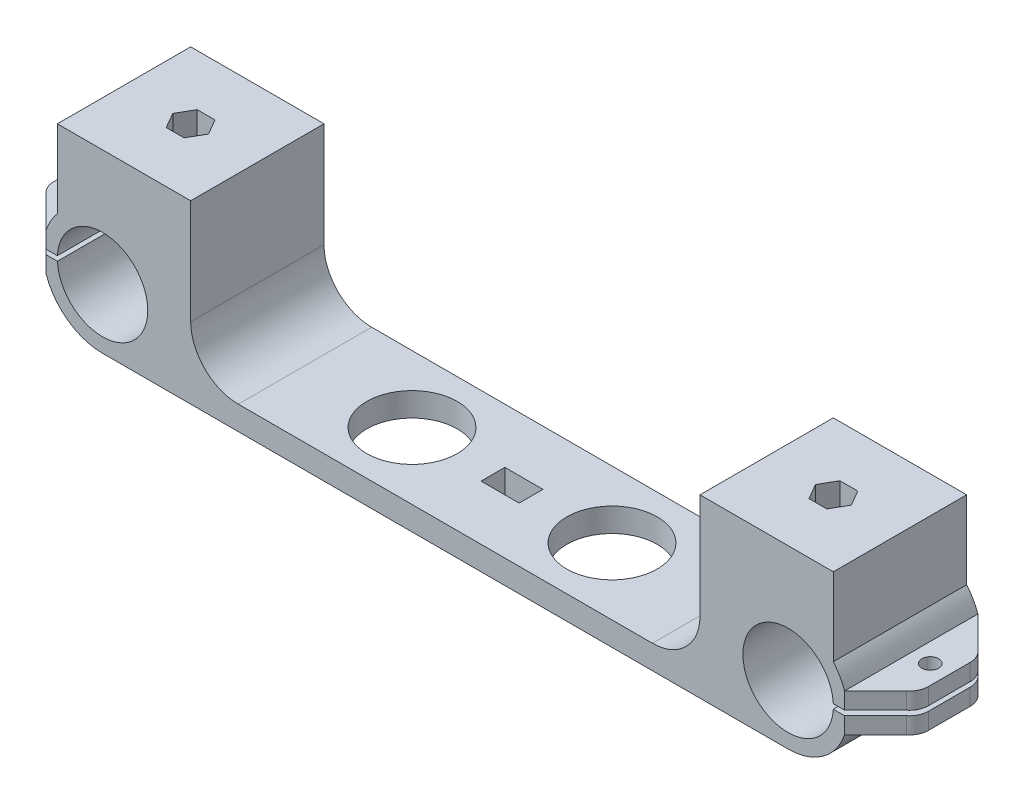
from build123d import *

# Parameters (mm, degrees)
BOSS_EXTRUDE3_DEPTH = 28
FILLET1_R           = 10
SKETCH8_R           = 9.5
SKETCH8_W           = 8
SKETCH8_H           = 5
CUT_EXTRUDE4_DEPTH  = 5
SKETCH9_R           = 1.75
CUT_EXTRUDE5_DEPTH  = 20
SKETCH10_R          = 1.75
CUT_EXTRUDE6_DEPTH  = 10
CUT_EXTRUDE8_DEPTH  = 10
CHAMFER1_SIZE       = 6.5
FILLET3_R           = 4
CUT_EXTRUDE9_DEPTH  = 5


# Some blends are built 0.0001 mm under size
with BuildPart() as part:
    # Sketch7 → Boss-Extrude3 (new body)
    with BuildSketch(Plane.XY):
        with BuildLine():
            Line((-29.009414831, -4.685297633), (114.990585169, -4.685297633))
            ThreePointArc((114.990585169, -4.685297633), (122.279275038, -2.340345638), (126.833304451, 3.814702367))
            Line((126.833304451, 3.814702367), (134.833304451, 3.814702367))
            Line((134.833304451, 3.814702367), (134.833304451, 7.314702367))
            Line((134.833304451, 7.314702367), (127.480581166, 7.314702367))
            Line((127.480581166, 7.314702367), (124.47741815, 7.314702367))
            ThreePointArc((124.47741815, 7.314702367), (105.490585169, 7.814702367), (124.47741815, 8.314702367))
            Line((124.47741815, 8.314702367), (127.480581166, 8.314702367))
            Line((127.480581166, 8.314702367), (134.833304451, 8.314702367))
            Line((134.833304451, 8.314702367), (134.833304451, 11.814702367))
            Line((134.833304451, 11.814702367), (126.833304451, 11.814702367))
            ThreePointArc((126.833304451, 11.814702367), (125.854338173, 13.997652364), (124.47741815, 15.954112665))
            Line((124.47741815, 15.954112665), (124.47741815, 32.314702367))
            Line((124.47741815, 32.314702367), (96.47741815, 32.314702367))
            Line((96.47741815, 32.314702367), (96.47741815, 0.314702367))
            Line((96.47741815, 0.314702367), (-10.496247811, 0.314702367))
            Line((-10.496247811, 0.314702367), (-10.496247811, 32.314702367))
            Line((-10.496247811, 32.314702367), (-38.496247811, 32.314702367))
            Line((-38.496247811, 32.314702367), (-38.496247811, 15.954112665))
            ThreePointArc((-38.496247811, 15.954112665), (-39.873167835, 13.997652364), (-40.852134113, 11.814702367))
            Line((-40.852134113, 11.814702367), (-48.852134113, 11.814702367))
            Line((-48.852134113, 11.814702367), (-48.852134113, 8.314702367))
            Line((-48.852134113, 8.314702367), (-41.499410828, 8.314702367))
            Line((-41.499410828, 8.314702367), (-38.496247811, 8.314702367))
            ThreePointArc((-38.496247811, 8.314702367), (-19.509414831, 7.814702367), (-38.496247811, 7.314702367))
            Line((-38.496247811, 7.314702367), (-41.499410828, 7.314702367))
            Line((-41.499410828, 7.314702367), (-48.852134113, 7.314702367))
            Line((-48.852134113, 7.314702367), (-48.852134113, 3.814702367))
            Line((-48.852134113, 3.814702367), (-40.852134113, 3.814702367))
            ThreePointArc((-40.852134113, 3.814702367), (-36.298104699, -2.340345638), (-29.009414831, -4.685297633))
        make_face()
    extrude(amount=BOSS_EXTRUDE3_DEPTH)

    # Fillet1
    fillet1_edges = [part.edges().sort_by_distance(p)[0] for p in [
        (-10.496247811, 0.314702367, 14),
        (96.47741815, 0.314702367, 14),
    ]]
    fillet(fillet1_edges, radius=FILLET1_R)

    # Sketch8 → Cut-Extrude4 (cut)
    with BuildSketch(Plane(origin=(0, 0.314702367, 0), x_dir=(1, 0, 0), z_dir=(0, 1, 0))):
        with Locations(Location((63.990585169, -14, 0), (0, 0, 270))):
            Circle(SKETCH8_R)
        with Locations(Location((21.990585169, -14, 0), (0, 0, 270))):
            Circle(SKETCH8_R)
        with Locations((42.990585169, -14)):
            Rectangle(SKETCH8_W, SKETCH8_H)
    extrude(amount=-CUT_EXTRUDE4_DEPTH, mode=Mode.SUBTRACT)

    # Sketch9 → Cut-Extrude5 (cut)
    with BuildSketch(Plane(origin=(0, 11.814702367, 0), x_dir=(1, 0, 0), z_dir=(0, 1, 0))):
        with Locations(Location((130.833304451, -14, 0), (0, 0, 270))):
            Circle(SKETCH9_R)
        with Locations(Location((-44.852134113, -14, 0), (0, 0, 180))):
            Circle(SKETCH9_R)
    extrude(amount=-CUT_EXTRUDE5_DEPTH, mode=Mode.SUBTRACT)

    # Sketch10 → Cut-Extrude6 (cut)
    with BuildSketch(Plane(origin=(0, 32.314702367, 0), x_dir=(1, 0, 0), z_dir=(0, 1, 0))):
        with Locations(Location((110.490585169, -14, 0), (0, 0, 180))):
            Circle(SKETCH10_R)
        with Locations(Location((-24.509414831, -14, 0), (0, 0, 180))):
            Circle(SKETCH10_R)
    extrude(amount=-CUT_EXTRUDE6_DEPTH, mode=Mode.SUBTRACT)

    # Sketch12 → Cut-Extrude8 (cut)
    with BuildSketch(Plane(origin=(0, 11.814702367, 0), x_dir=(1, 0, 0), z_dir=(0, 1, 0))):
        Polygon((130.833304451, -21.5), (126.833304451, -21.5), (126.833304451, -28), (134.833304451, -28), (134.833304451, -21.5), align=None)
        Polygon((130.833304451, -6.5), (126.833304451, -6.5), (126.833304451, 0), (134.833304451, 0), (134.833304451, -6.5), align=None)
        Polygon((-44.852134113, -6.5), (-40.852134113, -6.5), (-40.852134113, 0), (-48.852134113, 0), (-48.852134113, -6.5), align=None)
        Polygon((-44.852134113, -21.5), (-48.852134113, -21.5), (-48.852134113, -28), (-40.852134113, -28), (-40.852134113, -21.5), align=None)
    extrude(amount=-CUT_EXTRUDE8_DEPTH, mode=Mode.SUBTRACT)

    # Chamfer1
    chamfer1_edges = [part.edges().sort_by_distance(p)[0] for p in [
        (126.833304451, 10.064702367, 6.5),
        (126.833304451, 5.564702367, 6.5),
        (126.833304451, 5.564702367, 21.5),
        (126.833304451, 10.064702367, 21.5),
        (-40.852134113, 5.564702367, 21.5),
        (-40.852134113, 5.564702367, 6.5),
        (-40.852134113, 10.064702367, 6.5),
        (-40.852134113, 10.064702367, 21.5),
    ]]
    chamfer(chamfer1_edges, length=CHAMFER1_SIZE - 0.0001)  # a hair under: the kernel refuses the full size

    # Fillet3
    # the kernel refuses this fillet: 4 mm, written as the material it takes off along each edge
    with BuildSketch(Plane(origin=(134.833304451, 19.621150019, 21.5), x_dir=(-1, 0, 0), z_dir=(0, -1, 0))) as fillet3_piece_1:
        with BuildLine():
            CenterArc((4, 3.122579061), FILLET3_R, 180, 51.319647456)
            Line((0, 3.122579061), (-0.08, 3.122579061))
            Line((-0.08, 3.122579061), (-0.08, 0))
            Line((-0.08, 0), (0, -0.08))
            ThreePointArc((0, -0.08), (0.75005, -0.08), (1.450102, -0.062451581))
            Line((1.450102, -0.062451581), (1.5001, 0))
        make_face()
    extrude(amount=19.112895303, mode=Mode.SUBTRACT)
    with BuildSketch(Plane(origin=(134.833304451, 15.121150019, 21.5), x_dir=(0, 0, -1), z_dir=(0, -1, 0)), Plane(origin=(-48.852134113, 15.121150019, 6.5), x_dir=(0, 0, 1), z_dir=(0, -1, 0)), Plane(origin=(-48.852134113, 19.621150019, 6.5), x_dir=(0, 0, 1), z_dir=(0, -1, 0))) as fillet3_piece_2:
        with BuildLine():
            CenterArc((3.122579061, -4), FILLET3_R, 90, 51.319647456)
            Line((0, -1.5001), (-0.062451581, -1.450102))
            ThreePointArc((-0.062451581, -1.450102), (-0.08, -0.75005), (-0.08, 0))
            Line((-0.08, 0), (0, 0.08))
            Line((0, 0.08), (3.122579061, 0.08))
            Line((3.122579061, 0.08), (3.122579061, 0))
        make_face()
    extrude(amount=19.112895303, mode=Mode.SUBTRACT)
    with BuildSketch(Plane(origin=(134.833304451, 15.121150019, 6.5), x_dir=(0, 0, 1), z_dir=(0, -1, 0)), Plane(origin=(134.833304451, 19.621150019, 6.5), x_dir=(0, 0, 1), z_dir=(0, -1, 0)), Plane(origin=(-48.852134113, 19.621150019, 21.5), x_dir=(0, 0, -1), z_dir=(0, -1, 0))) as fillet3_piece_3:
        with BuildLine():
            CenterArc((3.122579061, 4), FILLET3_R, 218.680352544, 51.319647456)
            Line((0, 1.5001), (-0.062451581, 1.450102))
            ThreePointArc((-0.062451581, 1.450102), (-0.08, 0.75005), (-0.08, 0))
            Line((-0.08, 0), (0, -0.08))
            Line((0, -0.08), (3.122579061, -0.08))
            Line((3.122579061, -0.08), (3.122579061, 0))
        make_face()
    extrude(amount=19.112895303, mode=Mode.SUBTRACT)
    with BuildSketch(Plane(origin=(-48.852134113, 15.121150019, 21.5), x_dir=(1, 0, 0), z_dir=(0, -1, 0))) as fillet3_piece_4:
        with BuildLine():
            CenterArc((4, -3.122579061), FILLET3_R, 128.680352544, 51.319647456)
            Line((0, -3.122579061), (-0.08, -3.122579061))
            Line((-0.08, -3.122579061), (-0.08, 0))
            Line((-0.08, 0), (0, 0.08))
            ThreePointArc((0, 0.08), (0.75005, 0.08), (1.450102, 0.062451581))
            Line((1.450102, 0.062451581), (1.5001, 0))
        make_face()
    extrude(amount=19.112895303, mode=Mode.SUBTRACT)

    # Sketch13 → Cut-Extrude9 (cut)
    with BuildSketch(Plane(origin=(0, 32.314702367, 0), x_dir=(1, 0, 0), z_dir=(0, 1, 0))):
        Polygon((108.614196794, -17.25), (112.366973544, -17.25), (114.243361919, -14), (112.366973544, -10.75), (108.614196794, -10.75), (106.737808419, -14), align=None)
        Polygon((-20.756638081, -14), (-22.633026456, -10.75), (-26.385803206, -10.75), (-28.262191581, -14), (-26.385803206, -17.25), (-22.633026456, -17.25), align=None)
    extrude(amount=-CUT_EXTRUDE9_DEPTH, mode=Mode.SUBTRACT)


solid = part.part
